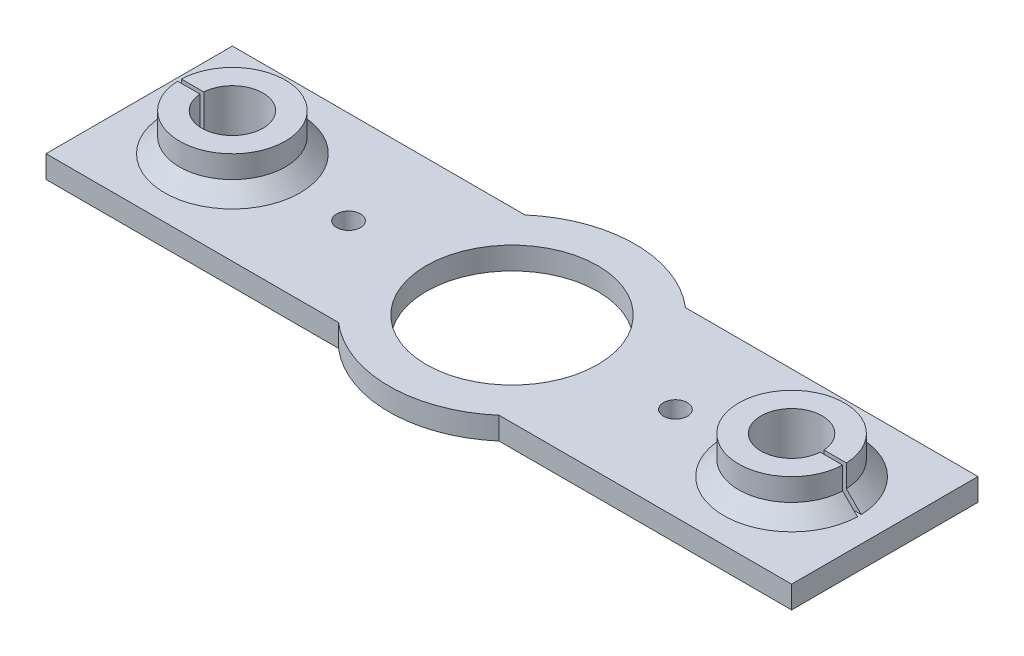
from build123d import *

# Parameters (mm, degrees)
SKETCH1_R           = 1.6
SKETCH1_R_2         = 4.1
SKETCH1_R_3         = 11.5
BOSS_EXTRUDE1_DEPTH = 3
BOSS_EXTRUDE2_DEPTH = 5
CHAMFER1_SIZE       = 2


with BuildPart() as part:
    # Sketch1 → Boss-Extrude1 (new body)
    with BuildSketch(Plane(origin=(0, 0, 0), x_dir=(1, 0, 0), z_dir=(0, 1, 0))):
        with BuildLine():
            Line((10.770329614, -12.5), (50, -12.5))
            Line((50, -12.5), (50, 12.5))
            Line((50, 12.5), (10.770329614, 12.5))
            ThreePointArc((10.770329614, 12.5), (0, 16.5), (-10.770329614, 12.5))
            Line((-10.770329614, 12.5), (-50, 12.5))
            Line((-50, 12.5), (-50, -12.5))
            Line((-50, -12.5), (-10.770329614, -12.5))
            ThreePointArc((-10.770329614, -12.5), (0, -16.5), (10.770329614, -12.5))
        make_face()
        with Locations((21.92, 0)):
            Circle(SKETCH1_R, mode=Mode.SUBTRACT)
        with Locations((37.5, 0)):
            Circle(SKETCH1_R_2, mode=Mode.SUBTRACT)
        Circle(SKETCH1_R_3, mode=Mode.SUBTRACT)
        with Locations((-21.92, 0)):
            Circle(SKETCH1_R, mode=Mode.SUBTRACT)
        with Locations((-37.5, 0)):
            Circle(SKETCH1_R_2, mode=Mode.SUBTRACT)
    extrude(amount=BOSS_EXTRUDE1_DEPTH)

    # Sketch2 → Boss-Extrude2 (add)
    with BuildSketch(Plane(origin=(0, 3, 0), x_dir=(1, 0, 0), z_dir=(0, 1, 0))):
        with BuildLine():
            Line((-44.59313577, 0.25), (-41.592370951, 0.25))
            ThreePointArc((-41.592370951, 0.25), (-33.4, 0), (-41.592370951, -0.25))
            Line((-41.592370951, -0.25), (-44.59313577, -0.25))
            ThreePointArc((-44.59313577, -0.25), (-30.402459929, 0), (-44.59313577, 0.25))
        make_face()
        with BuildLine():
            ThreePointArc((41.592370951, -0.25), (33.4, 0), (41.592370951, 0.25))
            Line((41.592370951, 0.25), (44.59313577, 0.25))
            ThreePointArc((44.59313577, 0.25), (30.402459929, 0), (44.59313577, -0.25))
            Line((44.59313577, -0.25), (41.592370951, -0.25))
        make_face()
    extrude(amount=BOSS_EXTRUDE2_DEPTH)

    # Chamfer1
    chamfer1_edges = [part.edges().sort_by_distance(p)[0] for p in [
        (30.402459929, 3, 0),
        (-30.402459929, 3, 0),
    ]]
    chamfer(chamfer1_edges, length=CHAMFER1_SIZE)


solid = part.part
